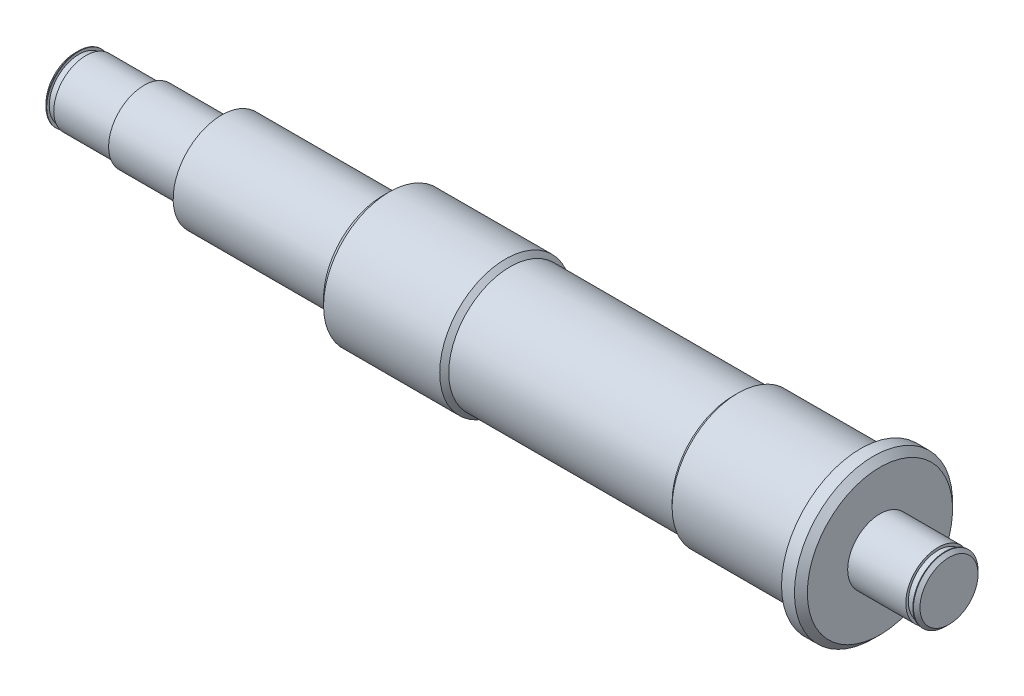
from build123d import *

# Parameters (mm, degrees)
SFAZOWANIE1_SIZE           = 1
SFAZOWANIE2_SIZE           = 0.5
WYTNIJ_WYCI_GNI_CIE1_START = -25
WYTNIJ_WYCI_GNI_CIE1_DEPTH = 25


with BuildPart() as part:
    # Szkic1 → Obrót1 (revolve)
    with BuildSketch(Plane.XY, mode=Mode.PRIVATE) as obr_t1_sk:
        Polygon((0, 0), (0, 5), (0.6, 5), (0.6, 4.6), (1.7, 4.6), (1.7, 5), (10.7, 5), (10.7, 5.5), (22.7, 5.5), (22.7, 7.5), (47.7, 7.5), (47.7, 10.2), (67.7, 10.2), (67.7, 9.5), (101.7, 9.5), (101.7, 10.2), (121.7, 10.2), (121.7, 12.25), (124.7, 12.25), (124.7, 5), (133.7, 5), (133.7, 4.6), (134.8, 4.6), (134.8, 5), (135.4, 5), (135.4, 0), align=None)
    revolve(obr_t1_sk.sketch.rotate(Axis((-10.674656103, 0, 0), (1, 0, 0)), 90), axis=Axis((-10.674656103, 0, 0), (1, 0, 0)))

    # Sfazowanie1
    # the kernel refuses this chamfer: 1 mm, written as the material it takes off along each edge
    with BuildSketch(Plane(origin=(101.7, 0, 0), x_dir=(0, 0, 1), z_dir=(0, 1, 0))) as sfazowanie1_piece_1_section:
        Polygon((10.2 - SFAZOWANIE1_SIZE, 0), (10.2, SFAZOWANIE1_SIZE), (10.2, 0), align=None)
    sfazowanie1_piece_1 = revolve(axis=Axis((101.7, 0, 0), (1, 0, 0)), mode=Mode.PRIVATE)
    sfazowanie1_piece_1 = sfazowanie1_piece_1 - Plane(origin=(102.341981052, 0, 0), x_dir=(0, 0, 1), z_dir=(1, 0, 0)) * Cylinder(9.5, 41, mode=Mode.PRIVATE)
    add(sfazowanie1_piece_1, mode=Mode.SUBTRACT)
    with BuildSketch(Plane(origin=(67.7, 0, 0), x_dir=(0, 0, 1), z_dir=(0, 1, 0))) as sfazowanie1_piece_2_section:
        Polygon((10.2, -SFAZOWANIE1_SIZE), (10.2 - SFAZOWANIE1_SIZE, 0), (10.2, 0), align=None)
    sfazowanie1_piece_2 = revolve(axis=Axis((67.7, 0, 0), (1, 0, 0)), mode=Mode.PRIVATE)
    sfazowanie1_piece_2 = sfazowanie1_piece_2 - Plane(origin=(67.058018948, 0, 0), x_dir=(0, 0, 1), z_dir=(1, 0, 0)) * Cylinder(9.5, 41, mode=Mode.PRIVATE)
    add(sfazowanie1_piece_2, mode=Mode.SUBTRACT)
    with BuildSketch(Plane(origin=(124.7, 0, 0), x_dir=(0, 0, 1), z_dir=(0, 1, 0))) as sfazowanie1_piece_3:
        Polygon((12.25, -SFAZOWANIE1_SIZE), (12.25 - SFAZOWANIE1_SIZE, 0), (12.25, 0), align=None)
    revolve(axis=Axis((124.7, 0, 0), (1, 0, 0)), mode=Mode.SUBTRACT)
    with BuildSketch(Plane(origin=(47.7, 0, 0), x_dir=(0, 0, 1), z_dir=(0, 1, 0))) as sfazowanie1_piece_4:
        Polygon((10.2 - SFAZOWANIE1_SIZE, 0), (10.2, SFAZOWANIE1_SIZE), (10.2, 0), align=None)
    revolve(axis=Axis((47.7, 0, 0), (1, 0, 0)), mode=Mode.SUBTRACT)

    # Sfazowanie2
    sfazowanie2_edges = [part.edges().sort_by_distance(p)[0] for p in [
        (135.4, 0, -5),
        (0, 0, -5),
    ]]
    chamfer(sfazowanie2_edges, length=SFAZOWANIE2_SIZE)

    # Szkic2 → Wytnij-wyciągnięcie1 (cut)
    with BuildSketch(Plane.ZY.offset(-22.7).offset(WYTNIJ_WYCI_GNI_CIE1_START)):
        with BuildLine():
            Line((4.5, -6), (-4.5, -6))
            ThreePointArc((-4.5, -6), (0, -7.5), (4.5, -6))
        make_face()
    extrude(amount=WYTNIJ_WYCI_GNI_CIE1_DEPTH, mode=Mode.SUBTRACT)


solid = part.part
